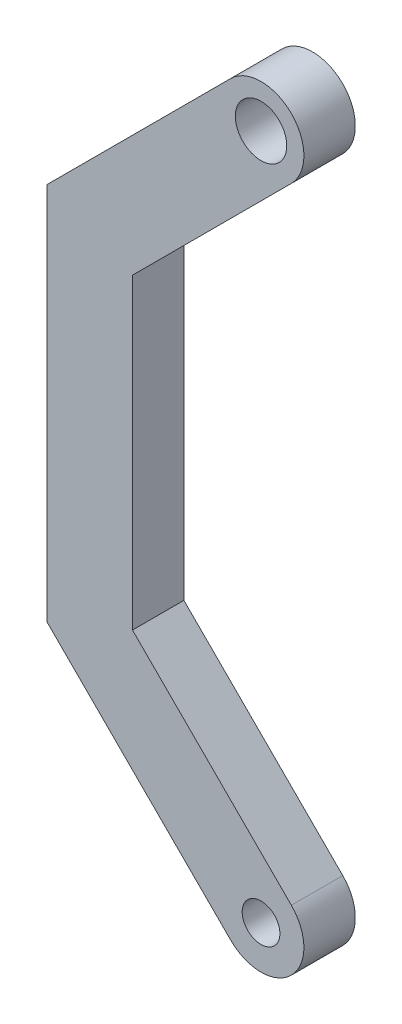
from build123d import *

# Parameters (mm, degrees)
CROQUIS1_R              = 1.1
CROQUIS1_R_2            = 1.5
SALIENTE_EXTRUIR1_DEPTH = 3


with BuildPart() as part:
    # Croquis1 → Saliente-Extruir1 (new body)
    with BuildSketch(Plane.XY):
        with BuildLine():
            Line((-12.5, 8.964466094), (-1.767766953, -1.767766953))
            ThreePointArc((-1.767766953, -1.767766953), (1.767766953, -1.767766953), (1.767766953, 1.767766953))
            Line((1.767766953, 1.767766953), (-7.5, 11.035533906))
            Line((-7.5, 11.035533906), (-7.5, 28.964466094))
            Line((-7.5, 28.964466094), (1.767766953, 38.232233047))
            ThreePointArc((1.767766953, 38.232233047), (1.767766953, 41.767766953), (-1.767766953, 41.767766953))
            Line((-1.767766953, 41.767766953), (-12.5, 31.035533906))
            Line((-12.5, 31.035533906), (-12.5, 8.964466094))
        make_face()
        Circle(CROQUIS1_R, mode=Mode.SUBTRACT)
        with Locations((0, 40)):
            Circle(CROQUIS1_R_2, mode=Mode.SUBTRACT)
    extrude(amount=SALIENTE_EXTRUIR1_DEPTH)


solid = part.part
